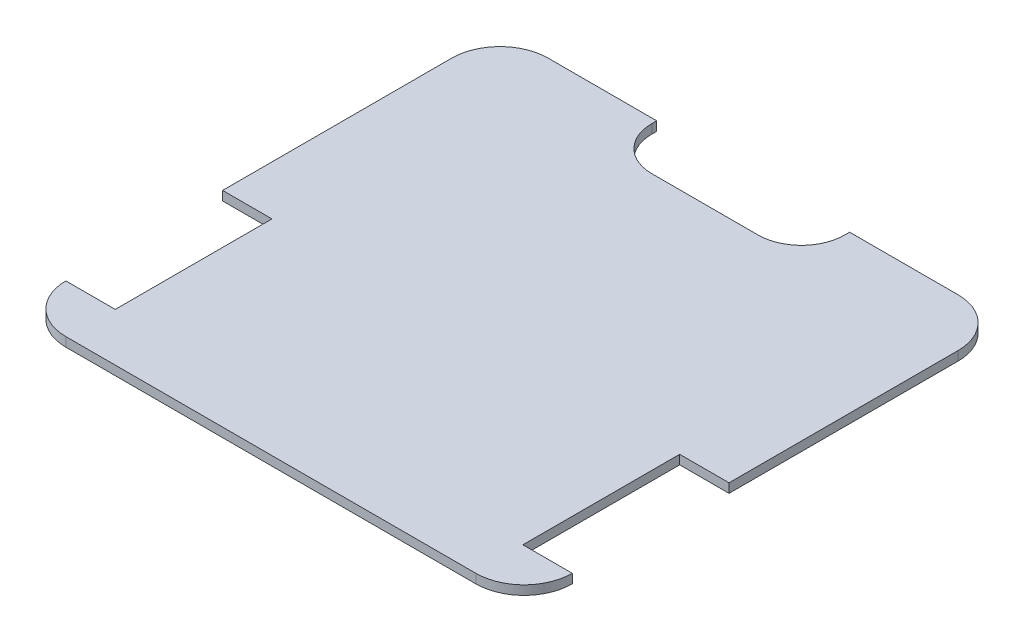
from build123d import *

# Parameters (mm, degrees)
SKETCH1_W           = 266.7
SKETCH1_H           = 254
BOSS_EXTRUDE1_DEPTH = 4.826
SKETCH2_W           = 26.00000007
SKETCH2_H           = 82.55
CUT_EXTRUDE1_DEPTH  = 4.826
CUT_EXTRUDE3_DEPTH  = 4.826
SKETCH7_W           = 101.6
SKETCH7_H           = 25.4
CUT_EXTRUDE5_DEPTH  = 4.826
FILLET9_R           = 22.86
FILLET10_R          = 22.86
CUT_EXTRUDE6_DEPTH  = 4.826


with BuildPart() as part:
    # Sketch1 → Boss-Extrude1 (new body)
    with BuildSketch(Plane(origin=(0, 0, 0), x_dir=(1, 0, 0), z_dir=(0, 1, 0))):
        Rectangle(SKETCH1_W, SKETCH1_H)
    extrude(amount=BOSS_EXTRUDE1_DEPTH)

    # Sketch2 → Cut-Extrude1 (cut)
    with BuildSketch(Plane(origin=(0, 4.826, 0), x_dir=(1, 0, 0), z_dir=(0, 1, 0))):
        with Locations((-120.349999965, -60.325)):
            Rectangle(SKETCH2_W, SKETCH2_H)
        with Locations((120.349999965, -60.325)):
            Rectangle(SKETCH2_W, SKETCH2_H)
    extrude(amount=-CUT_EXTRUDE1_DEPTH, mode=Mode.SUBTRACT)

    # Sketch4 → Cut-Extrude3 (cut)
    with BuildSketch(Plane(origin=(0, 4.826, 0), x_dir=(1, 0, 0), z_dir=(0, 1, 0))):
        with BuildLine():
            Line((-133.35, 101.6), (-133.35, 127))
            Line((-133.35, 127), (-107.95, 127))
            ThreePointArc((-107.95, 127), (-125.910512242, 119.560512242), (-133.35, 101.6))
        make_face()
        with BuildLine():
            Line((133.35, 101.6), (133.35, 127))
            Line((133.35, 127), (107.95, 127))
            ThreePointArc((107.95, 127), (125.910512242, 119.560512242), (133.35, 101.6))
        make_face()
    extrude(amount=-CUT_EXTRUDE3_DEPTH, mode=Mode.SUBTRACT)

    # Sketch7 → Cut-Extrude5 (cut)
    with BuildSketch(Plane(origin=(0, 4.826, 0), x_dir=(1, 0, 0), z_dir=(0, 1, 0))):
        with Locations((0, 114.3)):
            Rectangle(SKETCH7_W, SKETCH7_H)
    extrude(amount=-CUT_EXTRUDE5_DEPTH, mode=Mode.SUBTRACT)

    # Fillet9
    fillet9_edges = [part.edges().sort_by_distance(p)[0] for p in [
        (-50.8, 2.413, -101.6),
    ]]
    fillet(fillet9_edges, radius=FILLET9_R)

    # Fillet10
    fillet10_edges = [part.edges().sort_by_distance(p)[0] for p in [
        (50.8, 2.413, -101.6),
    ]]
    fillet(fillet10_edges, radius=FILLET10_R)

    # Sketch8 → Cut-Extrude6 (cut)
    with BuildSketch(Plane(origin=(0, 4.826, 0), x_dir=(1, 0, 0), z_dir=(0, 1, 0))):
        with BuildLine():
            Line((-133.35, -101.6), (-133.35, -127))
            Line((-133.35, -127), (-107.95, -127))
            ThreePointArc((-107.95, -127), (-125.910512242, -119.560512242), (-133.35, -101.6))
        make_face()
        with BuildLine():
            Line((133.35, -127), (107.95, -127))
            ThreePointArc((107.95, -127), (125.910512242, -119.560512242), (133.35, -101.6))
            Line((133.35, -101.6), (133.35, -127))
        make_face()
    extrude(amount=-CUT_EXTRUDE6_DEPTH, mode=Mode.SUBTRACT)


solid = part.part
